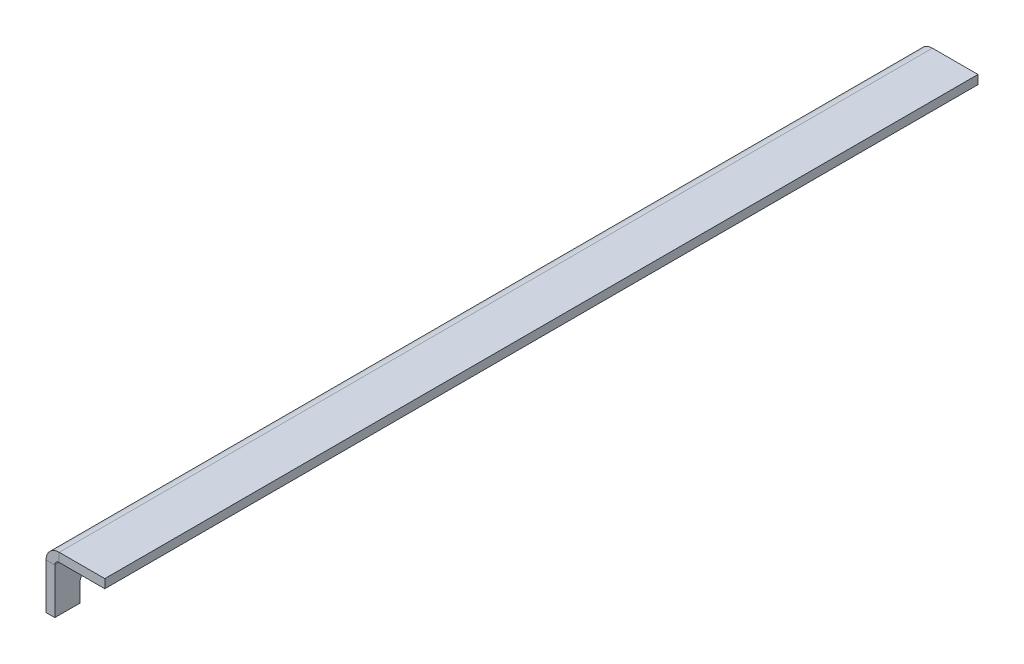
from build123d import *

# Parameters (mm, degrees)
SM_BASE_FLANGE_1_DEPTH = 148.5
CUT_EXTRUDE_1_DEPTH    = 151.802022533


# Sheet-metal steps are written as plain solids
with BuildPart() as part:
    # Sketch 2 → Базовая кромка1 (new body)
    with BuildSketch(Plane.XY):
        with BuildLine():
            Line((0, -20), (0, -4.5))
            ThreePointArc((0, -4.5), (1.318019485, -1.318019485), (4.5, 0))
            Line((4.5, 0), (20, 0))
            Line((20, 0), (20, -3))
            Line((20, -3), (4.5, -3))
            ThreePointArc((4.5, -3), (3.439339828, -3.439339828), (3, -4.5))
            Line((3, -4.5), (3, -20))
            Line((3, -20), (0, -20))
        make_face()
    extrude(amount=SM_BASE_FLANGE_1_DEPTH)

    # Эскиз10 → Вырез-Вытянуть1 (cut, through all)
    with BuildSketch(Plane(origin=(3, 0, 0), x_dir=(0, 0, -1), z_dir=(1, 0, 0))):
        with BuildLine():
            Line((-140, -25.5), (-140, -14.5))
            ThreePointArc((-140, -14.5), (-135, -9.5), (-130, -14.5))
            Line((-130, -14.5), (-130, -25.5))
            ThreePointArc((-130, -25.5), (-135, -30.5), (-140, -25.5))
        make_face()
    extrude(amount=-CUT_EXTRUDE_1_DEPTH, mode=Mode.SUBTRACT)

    # Зеркальное отражение1: part across plane


with BuildPart() as part_1:
    add(part.part)
    add(part.part.mirror(Plane(origin=(4.5, -4.5, 0), x_dir=(1, 0, 0), z_dir=(0, 0, 1))))


solid = part_1.part
